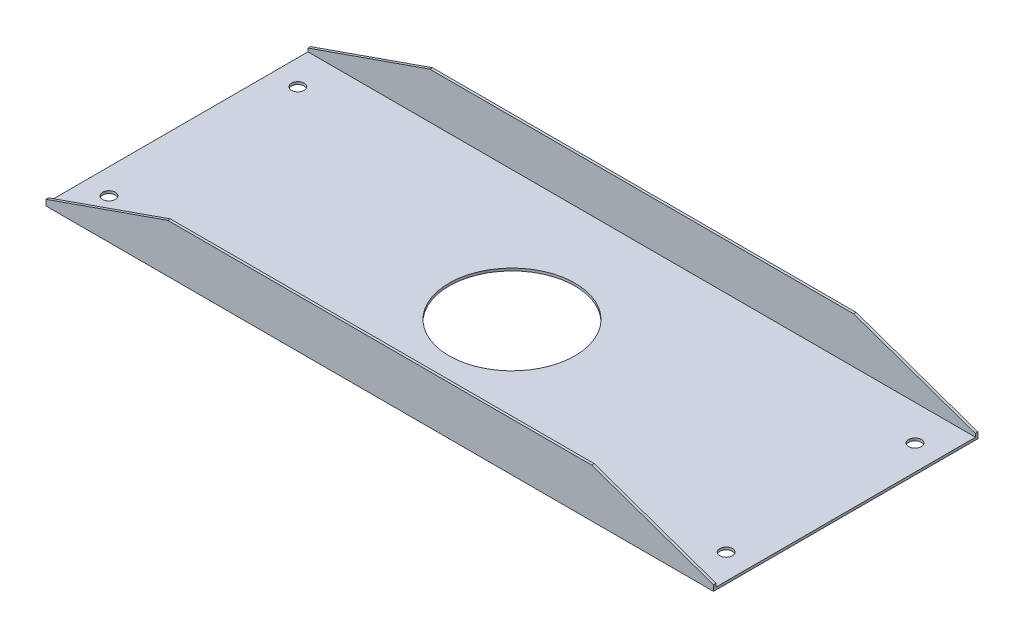
from build123d import *

# Parameters (mm, degrees)
EXTRUDE_1_DEPTH     = 530
SKETCH_2_OUTSIDE_W  = 646.278
SKETCH_2_OUTSIDE_H  = 154.778
CUT_EXTRUDE_2_DEPTH = 572.386252897
SKETCH_3_R          = 5
SKETCH_3_R_2        = 50
CUT_EXTRUDE_3_DEPTH = 542.532316672


with BuildPart() as part:
    # Эскиз1 → Вытянуть-Тонкостенный1 (new body)
    with BuildSketch(Plane(origin=(0, 0, 0), x_dir=(0, 0, -1), z_dir=(1, 0, 0))):
        Polygon((-105, 38.5), (-105, 0), (105, 0), (105, 38.5), (103, 38.5), (103, 2), (-103, 2), (-103, 38.5), align=None)
    extrude(amount=EXTRUDE_1_DEPTH)

    # Эскиз2 outside → Вырез-Вытянуть2 (cut, through all)
    with BuildSketch(Plane(origin=(0, 0, -105), x_dir=(-1, 0, 0), z_dir=(0, 0, -1))):
        with Locations((-265, 19.25)):
            Rectangle(SKETCH_2_OUTSIDE_W, SKETCH_2_OUTSIDE_H)
        Polygon((-530, 0), (-530, 4.614828056), (-433.275685346, 38.5), (-96.724314654, 38.5), (0, 4.614828056), (0, 0), align=None, mode=Mode.SUBTRACT)
    extrude(amount=-CUT_EXTRUDE_2_DEPTH, mode=Mode.SUBTRACT)

    # Эскиз3 → Вырез-Вытянуть3 (cut, through all)
    with BuildSketch(Plane(origin=(0, 2, 0), x_dir=(1, 0, 0), z_dir=(0, 1, 0))):
        with Locations((20, 75)):
            Circle(SKETCH_3_R)
        with Locations((20, -75)):
            Circle(SKETCH_3_R)
        with Locations((510, 75)):
            Circle(SKETCH_3_R)
        with Locations((510, -75)):
            Circle(SKETCH_3_R)
        with Locations((265, 0)):
            Circle(SKETCH_3_R_2)
    extrude(amount=-CUT_EXTRUDE_3_DEPTH, mode=Mode.SUBTRACT)


solid = part.part
